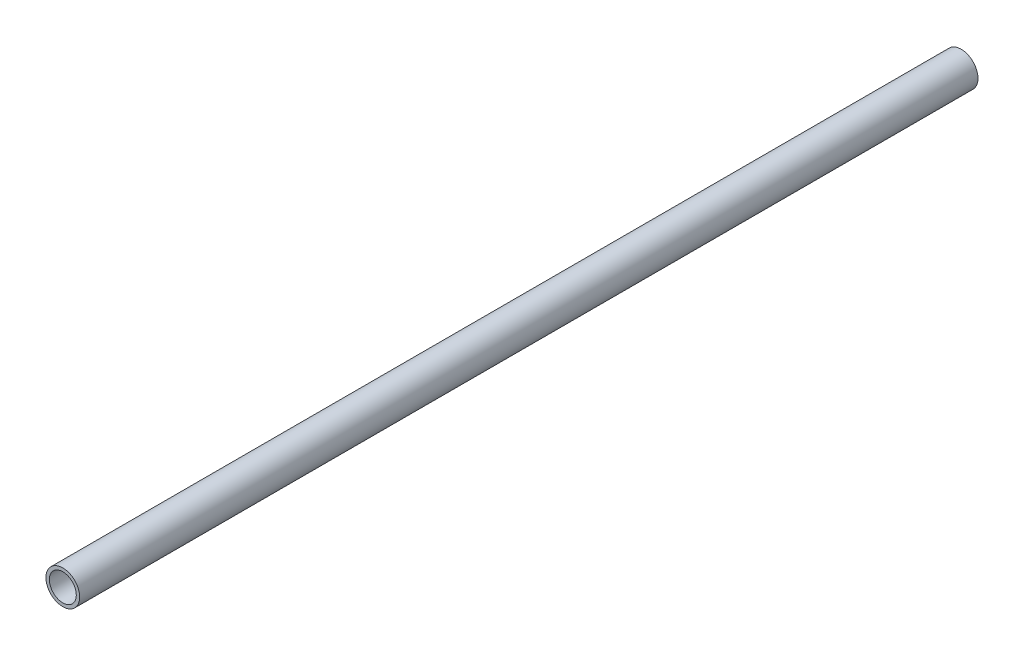
from build123d import *

# Parameters (mm, degrees)
SKETCH1_R           = 7.5
SKETCH1_R_2         = 6
BOSS_EXTRUDE1_DEPTH = 400


with BuildPart() as part:
    # Sketch1 → Boss-Extrude1 (new body)
    with BuildSketch(Plane.XY):
        with Locations((390.7614039, 31.081528881)):
            Circle(SKETCH1_R)
        with Locations((390.7614039, 31.081528881)):
            Circle(SKETCH1_R_2, mode=Mode.SUBTRACT)
    extrude(amount=BOSS_EXTRUDE1_DEPTH)


solid = part.part
